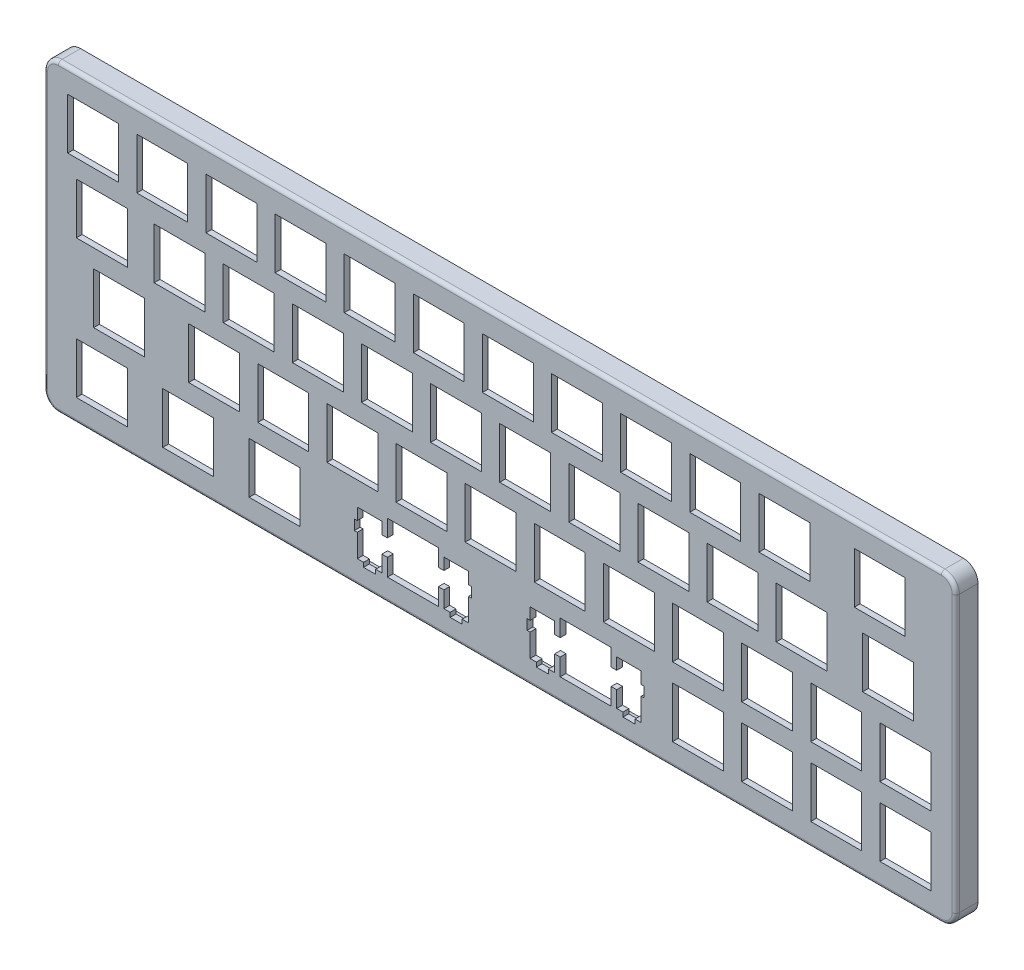
from build123d import *

# Parameters (mm, degrees)
SKETCH3_W           = 14
SKETCH3_H           = 14
BOSS_EXTRUDE1_DEPTH = 1.6
BOSS_EXTRUDE2_DEPTH = 4.5
FILLET2_R           = 1


with BuildPart() as part:
    # Sketch3 → Boss-Extrude1 (new body)
    with BuildSketch(Plane.XY):
        with BuildLine():
            Line((342.62, -106.45), (99.95, -106.45))
            ThreePointArc((99.95, -106.45), (97.121572875, -107.621572875), (95.95, -110.45))
            Line((95.95, -110.45), (95.95, -186.25))
            ThreePointArc((95.95, -186.25), (97.121572875, -189.078427125), (99.95, -190.25))
            Line((99.95, -190.25), (342.62, -190.25))
            ThreePointArc((342.62, -190.25), (345.448427125, -189.078427125), (346.62, -186.25))
            Line((346.62, -186.25), (346.62, -110.45))
            ThreePointArc((346.62, -110.45), (345.448427125, -107.621572875), (342.62, -106.45))
        make_face()
        with Locations((111.875, -177)):
            Rectangle(SKETCH3_W, SKETCH3_H, mode=Mode.SUBTRACT)
        with Locations((135.625, -177)):
            Rectangle(SKETCH3_W, SKETCH3_H, mode=Mode.SUBTRACT)
        with Locations((159.375, -177)):
            Rectangle(SKETCH3_W, SKETCH3_H, mode=Mode.SUBTRACT)
        Polygon((204.375, -184), (190.375, -184), (190.375, -179.288923941), (188.854357403, -179.288923941), (188.854357403, -183.758923941), (187.129357403, -183.758923941), (187.129357403, -184.958923941), (183.829357403, -184.958923941), (183.829357403, -183.758923941), (182.104357403, -183.758923941), (182.104357403, -177.473923941), (181.279357403, -177.473923941), (181.279357403, -174.688923941), (182.104357403, -174.688923941), (182.104357403, -171.458923941), (188.854357403, -171.458923941), (188.854357403, -174.688923941), (190.375, -174.688923941), (190.375, -170), (190.379357403, -170), (190.379357403, -169.988923941), (204.379357403, -169.988923941), (204.379357403, -174.688923941), (205.904357403, -174.688923941), (205.904357403, -171.458923941), (212.654357403, -171.458923941), (212.654357403, -174.688923941), (213.479357403, -174.688923941), (213.479357403, -177.473923941), (212.654357403, -177.473923941), (212.654357403, -183.758923941), (210.929357403, -183.758923941), (210.929357403, -184.958923941), (207.629357403, -184.958923941), (207.629357403, -183.758923941), (205.904357403, -183.758923941), (205.904357403, -179.288923941), (204.379357403, -179.288923941), (204.379357403, -183.988923941), (204.375, -183.988923941), align=None, mode=Mode.SUBTRACT)
        with Locations((116.625, -158)):
            Rectangle(SKETCH3_W, SKETCH3_H, mode=Mode.SUBTRACT)
        with Locations((142.75, -158)):
            Rectangle(SKETCH3_W, SKETCH3_H, mode=Mode.SUBTRACT)
        with Locations((161.75, -158)):
            Rectangle(SKETCH3_W, SKETCH3_H, mode=Mode.SUBTRACT)
        with Locations((180.75, -158)):
            Rectangle(SKETCH3_W, SKETCH3_H, mode=Mode.SUBTRACT)
        with Locations((199.75, -158)):
            Rectangle(SKETCH3_W, SKETCH3_H, mode=Mode.SUBTRACT)
        with Locations((218.75, -158)):
            Rectangle(SKETCH3_W, SKETCH3_H, mode=Mode.SUBTRACT)
        Polygon((237.875, -170), (237.878267062, -170), (237.878267062, -169.988923941), (251.878267062, -169.988923941), (251.878267062, -174.688923941), (253.403267062, -174.688923941), (253.403267062, -171.458923941), (260.153267062, -171.458923941), (260.153267062, -174.688923941), (260.978267062, -174.688923941), (260.978267062, -177.473923941), (260.153267062, -177.473923941), (260.153267062, -183.758923941), (258.428267062, -183.758923941), (258.428267062, -184.958923941), (255.128267062, -184.958923941), (255.128267062, -183.758923941), (253.403267062, -183.758923941), (253.403267062, -179.288923941), (251.878267062, -179.288923941), (251.878267062, -183.988923941), (251.875, -183.988923941), (251.875, -184), (237.875, -184), (237.875, -179.288923941), (236.353267062, -179.288923941), (236.353267062, -183.758923941), (234.628267062, -183.758923941), (234.628267062, -184.958923941), (231.328267062, -184.958923941), (231.328267062, -183.758923941), (229.603267062, -183.758923941), (229.603267062, -177.473923941), (228.778267062, -177.473923941), (228.778267062, -174.688923941), (229.603267062, -174.688923941), (229.603267062, -171.458923941), (236.353267062, -171.458923941), (236.353267062, -174.688923941), (237.875, -174.688923941), align=None, mode=Mode.SUBTRACT)
        with Locations((275.75, -177)):
            Rectangle(SKETCH3_W, SKETCH3_H, mode=Mode.SUBTRACT)
        with Locations((294.75, -177)):
            Rectangle(SKETCH3_W, SKETCH3_H, mode=Mode.SUBTRACT)
        with Locations((313.75, -177)):
            Rectangle(SKETCH3_W, SKETCH3_H, mode=Mode.SUBTRACT)
        with Locations((332.75, -177)):
            Rectangle(SKETCH3_W, SKETCH3_H, mode=Mode.SUBTRACT)
        with Locations((237.75, -158)):
            Rectangle(SKETCH3_W, SKETCH3_H, mode=Mode.SUBTRACT)
        with Locations((256.75, -158)):
            Rectangle(SKETCH3_W, SKETCH3_H, mode=Mode.SUBTRACT)
        with Locations((275.75, -158)):
            Rectangle(SKETCH3_W, SKETCH3_H, mode=Mode.SUBTRACT)
        with Locations((294.75, -158)):
            Rectangle(SKETCH3_W, SKETCH3_H, mode=Mode.SUBTRACT)
        with Locations((313.75, -158)):
            Rectangle(SKETCH3_W, SKETCH3_H, mode=Mode.SUBTRACT)
        with Locations((332.75, -158)):
            Rectangle(SKETCH3_W, SKETCH3_H, mode=Mode.SUBTRACT)
        with Locations((111.875, -139)):
            Rectangle(SKETCH3_W, SKETCH3_H, mode=Mode.SUBTRACT)
        with Locations((133.25, -139)):
            Rectangle(SKETCH3_W, SKETCH3_H, mode=Mode.SUBTRACT)
        with Locations((152.25, -139)):
            Rectangle(SKETCH3_W, SKETCH3_H, mode=Mode.SUBTRACT)
        with Locations((171.25, -139)):
            Rectangle(SKETCH3_W, SKETCH3_H, mode=Mode.SUBTRACT)
        with Locations((190.25, -139)):
            Rectangle(SKETCH3_W, SKETCH3_H, mode=Mode.SUBTRACT)
        with Locations((209.25, -139)):
            Rectangle(SKETCH3_W, SKETCH3_H, mode=Mode.SUBTRACT)
        with Locations((109.5, -120)):
            Rectangle(SKETCH3_W, SKETCH3_H, mode=Mode.SUBTRACT)
        with Locations((128.5, -120)):
            Rectangle(SKETCH3_W, SKETCH3_H, mode=Mode.SUBTRACT)
        with Locations((147.5, -120)):
            Rectangle(SKETCH3_W, SKETCH3_H, mode=Mode.SUBTRACT)
        with Locations((166.5, -120)):
            Rectangle(SKETCH3_W, SKETCH3_H, mode=Mode.SUBTRACT)
        with Locations((185.5, -120)):
            Rectangle(SKETCH3_W, SKETCH3_H, mode=Mode.SUBTRACT)
        with Locations((204.5, -120)):
            Rectangle(SKETCH3_W, SKETCH3_H, mode=Mode.SUBTRACT)
        with Locations((228.25, -139)):
            Rectangle(SKETCH3_W, SKETCH3_H, mode=Mode.SUBTRACT)
        with Locations((247.25, -139)):
            Rectangle(SKETCH3_W, SKETCH3_H, mode=Mode.SUBTRACT)
        with Locations((266.25, -139)):
            Rectangle(SKETCH3_W, SKETCH3_H, mode=Mode.SUBTRACT)
        with Locations((285.25, -139)):
            Rectangle(SKETCH3_W, SKETCH3_H, mode=Mode.SUBTRACT)
        with Locations((304.25, -139)):
            Rectangle(SKETCH3_W, SKETCH3_H, mode=Mode.SUBTRACT)
        with Locations((328, -139)):
            Rectangle(SKETCH3_W, SKETCH3_H, mode=Mode.SUBTRACT)
        with Locations((223.5, -120)):
            Rectangle(SKETCH3_W, SKETCH3_H, mode=Mode.SUBTRACT)
        with Locations((242.5, -120)):
            Rectangle(SKETCH3_W, SKETCH3_H, mode=Mode.SUBTRACT)
        with Locations((261.5, -120)):
            Rectangle(SKETCH3_W, SKETCH3_H, mode=Mode.SUBTRACT)
        with Locations((280.5, -120)):
            Rectangle(SKETCH3_W, SKETCH3_H, mode=Mode.SUBTRACT)
        with Locations((299.5, -120)):
            Rectangle(SKETCH3_W, SKETCH3_H, mode=Mode.SUBTRACT)
        with Locations((325.72, -120)):
            Rectangle(SKETCH3_W, SKETCH3_H, mode=Mode.SUBTRACT)
    extrude(amount=BOSS_EXTRUDE1_DEPTH)

    # Sketch1 → Boss-Extrude2 (add)
    with BuildSketch(Plane.XY):
        with BuildLine():
            Line((342.620001494, -106.45), (99.949998506, -106.45))
            ThreePointArc((99.949998506, -106.45), (97.121572438, -107.621572438), (95.95, -110.449998506))
            Line((95.95, -110.449998506), (95.95, -186.250001494))
            ThreePointArc((95.95, -186.250001494), (97.121572438, -189.078427562), (99.949998506, -190.25))
            Line((99.949998506, -190.25), (342.620001494, -190.25))
            ThreePointArc((342.620001494, -190.25), (345.448427562, -189.078427562), (346.62, -186.250001494))
            Line((346.62, -186.250001494), (346.62, -110.449998506))
            ThreePointArc((346.62, -110.449998506), (345.448427562, -107.621572438), (342.620001494, -106.45))
        make_face()
        with BuildLine():
            ThreePointArc((97.45, -110.449998506), (98.182232609, -108.682232609), (99.949998506, -107.95))
            Line((99.949998506, -107.95), (342.620001494, -107.95))
            ThreePointArc((342.620001494, -107.95), (344.387767391, -108.682232609), (345.12, -110.449998506))
            Line((345.12, -110.449998506), (345.12, -186.250001494))
            ThreePointArc((345.12, -186.250001494), (344.387767391, -188.017767391), (342.620001494, -188.75))
            Line((342.620001494, -188.75), (99.949998506, -188.75))
            ThreePointArc((99.949998506, -188.75), (98.182232609, -188.017767391), (97.45, -186.250001494))
            Line((97.45, -186.250001494), (97.45, -110.449998506))
        make_face(mode=Mode.SUBTRACT)
    extrude(amount=-BOSS_EXTRUDE2_DEPTH)

    # Fillet2
    fillet2_edges = [part.edges().sort_by_distance(p)[0] for p in [
        (97.121572875, -107.621572875, 1.6),
        (95.95, -148.35, 1.6),
        (97.121572875, -189.078427125, 1.6),
        (221.285, -190.25, 1.6),
        (345.448427125, -189.078427125, 1.6),
        (346.62, -148.35, 1.6),
        (345.448427125, -107.621572875, 1.6),
        (221.285, -106.45, 1.6),
    ]]
    fillet(fillet2_edges, radius=FILLET2_R)


solid = part.part
